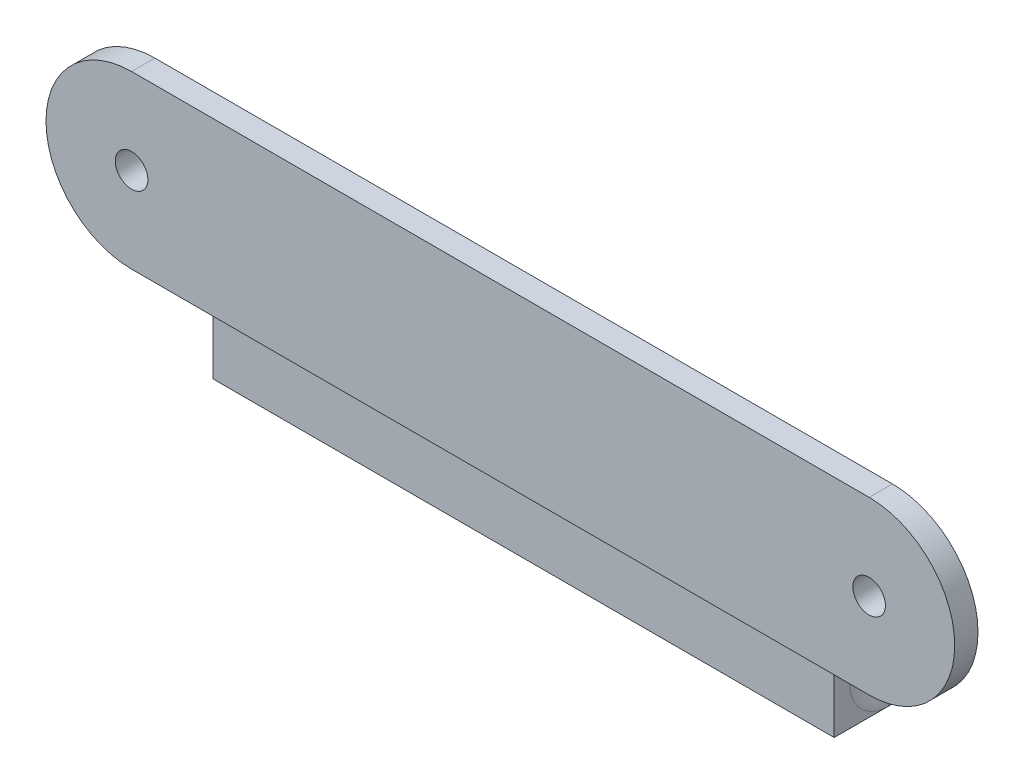
from build123d import *

# Parameters (mm, degrees)
SKETCH1_R               = 2.1
BOSS_EXTRUDE1_DEPTH     = 3
BOSS_EXTRUDE2_DEPTH     = 40
FILLET1_R               = 18
SKETCH2_W               = 80
SKETCH2_H               = 3
BOSS_EXTRUDE3_DEPTH     = 8
FILLET2_R               = 2
CUT_EXTRUDE1_DEPTH      = 111.696432989
CUT_EXTRUDE1_DEPTH_BACK = 111.696432989
SKETCH3_R               = 1.6
FILLET3_R               = 3


# Some blends are built 0.0001 mm under size
with BuildPart() as part:
    # Sketch1 → Boss-Extrude1 (new body)
    with BuildSketch(Plane.XY):
        with BuildLine():
            Line((0, 11.023468057), (95, 11.023468057))
            ThreePointArc((95, 11.023468057), (106.023468057, 0), (95, -11.023468057))
            Line((95, -11.023468057), (0, -11.023468057))
            ThreePointArc((0, -11.023468057), (-11.023468057, 0), (0, 11.023468057))
        make_face()
        Circle(SKETCH1_R, mode=Mode.SUBTRACT)
        with Locations((95, 0)):
            Circle(SKETCH1_R, mode=Mode.SUBTRACT)
    extrude(amount=BOSS_EXTRUDE1_DEPTH)

    # 3DSketch1 → Boss-Extrude2 (add, symmetric)
    with BuildSketch(Plane(origin=(47.5, 3.976531943, 0), x_dir=(0, -0.9805806756909202, -0.19611613513818404), z_dir=(-1, 0, 0))):
        Polygon((0, 0), (0.980580676, -4.902903378), (25.495097568, 0), (24.514516892, 4.902903378), align=None)
    extrude(amount=BOSS_EXTRUDE2_DEPTH, both=True)

    # Fillet1
    # the kernel refuses this fillet: 18 mm, written as the material it takes off along each edge
    with BuildSketch(Plane(origin=(118.624748995, 3.976531943, -5), x_dir=(0, 0, 1), z_dir=(-1, 0, 0))) as fillet1_piece_1:
        with BuildLine():
            CenterArc((18, -12.449899598), FILLET1_R, 136.238257307, 43.761742693)
            Line((0, -12.449899598), (-0.36, -12.449899598))
            Line((-0.36, -12.449899598), (-0.36, 0))
            Line((-0.36, 0), (0, 0.36))
            ThreePointArc((0, 0.36), (2.5, 0.36), (4.74, 0.248997992))
            Line((4.74, 0.248997992), (5, 0))
        make_face()
    extrude(amount=142.24949799, mode=Mode.SUBTRACT)

    # Sketch2 → Boss-Extrude3 (add)
    with BuildSketch(Plane(origin=(0, 0, -5), x_dir=(-1, 0, 0), z_dir=(0, 0, -1))):
        with Locations((-47.5, -19.523468057)):
            Rectangle(SKETCH2_W, SKETCH2_H)
    extrude(amount=BOSS_EXTRUDE3_DEPTH)

    # Fillet2
    fillet2_edges = [part.edges().sort_by_distance(p)[0] for p in [
        (47.5, -18.023468057, -5),
    ]]
    fillet(fillet2_edges, radius=FILLET2_R)

    # Sketch3 → Cut-Extrude1 (cut, two sides: drawn at the far end of the back side and taken through both)
    with BuildSketch(Plane(origin=(0, -18.023468057, 0), x_dir=(1, 0, 0), z_dir=(0, 1, 0)).offset(-CUT_EXTRUDE1_DEPTH_BACK)):
        with Locations(Location((17.5, 10.125300862, 0), (0, 0, 90))):
            Circle(SKETCH3_R)
        with Locations(Location((77.5, 10.125300862, 0), (0, 0, 90))):
            Circle(SKETCH3_R)
    extrude(amount=CUT_EXTRUDE1_DEPTH + CUT_EXTRUDE1_DEPTH_BACK, mode=Mode.SUBTRACT)

    # Fillet3
    fillet3_edges = [part.edges().sort_by_distance(p)[0] for p in [
        (7.5, -1.765163723, -3.703293088),
        (87.5, -1.765163723, -3.703293088),
        (7.5, -18.023468057, -10),
        (7.5, -17.43768162, -5.585786438),
        (87.5, -17.43768162, -5.585786438),
        (87.5, -18.023468057, -10),
        (87.5, -12.248417856, -5),
        (7.5, -12.248417856, -5),
    ]]
    fillet(fillet3_edges, radius=FILLET3_R - 0.0001)  # a hair under: the kernel refuses the full size


solid = part.part
